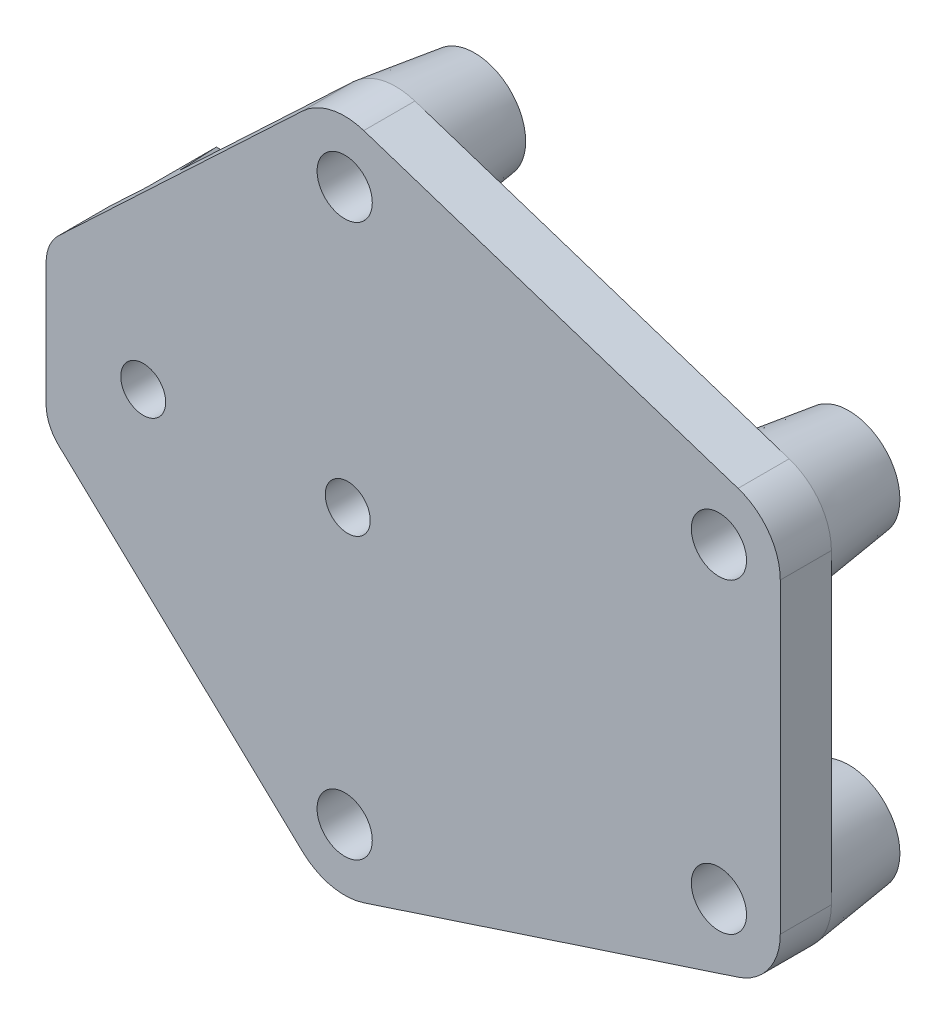
from build123d import *

# Parameters (mm, degrees)
SKETCH_1_R       = 2.7
SKETCH_1_R_2     = 2.2
EXTRUDE_1_DEPTH  = 5
SKETCH_1_4_W     = 29.647183795
SKETCH_1_4_H     = 2
EXTRUDE_2_DEPTH  = 6.8
CHAMFER_1_SIZE   = 3
CHAMFER_1_SIZE_2 = 6.8
CHAMFER_2_SIZE   = 3
CHAMFER_2_SIZE_2 = 6.8


with BuildPart() as part:
    # 草图1 → 凸台-拉伸1 (new body)
    with BuildSketch(Plane.XY):
        with BuildLine():
            Line((-22.414990858, 31.366560458), (-46.243327239, 8.911040306))
            ThreePointArc((-46.243327239, 8.911040306), (-47.17241807, 7.585353438), (-47.5, 6))
            Line((-47.5, 6), (-47.5, -6))
            ThreePointArc((-47.5, -6), (-47.17241807, -7.585353438), (-46.243327239, -8.911040306))
            Line((-46.243327239, -8.911040306), (-22.414990858, -31.366560458))
            ThreePointArc((-22.414990858, -31.366560458), (-19.606220239, -32.85608988), (-16.430695985, -32.701377246))
            Line((-16.430695985, -32.701377246), (20.169304015, -20.701377246))
            ThreePointArc((20.169304015, -20.701377246), (23.158797387, -18.520239758), (24.3, -15))
            Line((24.3, -15), (24.3, 15))
            ThreePointArc((24.3, 15), (23.158797387, 18.520239758), (20.169304015, 20.701377246))
            Line((20.169304015, 20.701377246), (-16.430695985, 32.701377246))
            ThreePointArc((-16.430695985, 32.701377246), (-19.606220239, 32.85608988), (-22.414990858, 31.366560458))
        make_face()
        with Locations((18.3, -15)):
            Circle(SKETCH_1_R, mode=Mode.SUBTRACT)
        with Locations((-38, 0)):
            Circle(SKETCH_1_R_2, mode=Mode.SUBTRACT)
        with Locations((-18, 0)):
            Circle(SKETCH_1_R_2, mode=Mode.SUBTRACT)
        with Locations((-18.3, 27)):
            Circle(SKETCH_1_R, mode=Mode.SUBTRACT)
        with Locations((18.3, 15)):
            Circle(SKETCH_1_R, mode=Mode.SUBTRACT)
        with Locations((-18.3, -27)):
            Circle(SKETCH_1_R, mode=Mode.SUBTRACT)
    extrude(amount=EXTRUDE_1_DEPTH)

    # 草图4 → 旋转1 (revolve)
    with BuildSketch(Plane(origin=(6.216937636, 18.961659791, 0), x_dir=(-0.9502295409734977, 0.31155066917163887, 0), z_dir=(-0.31155066917163887, -0.9502295409734977, 0)), mode=Mode.PRIVATE) as revolve_1_sk:
        Polygon((-6.715940562, 0), (-7.715940562, 7.7), (-10.015940562, 7.7), (-10.015940562, 0), align=None)
    revolve_1 = revolve(revolve_1_sk.sketch.rotate(Axis((18.3, 15, 4.45283877), (0, 0, -1)), 161.847294113), axis=Axis((18.3, 15, 4.45283877), (0, 0, -1)))

    # 草图4<3> → 旋转2 (revolve)
    with BuildSketch(Plane(origin=(6.216937636, 18.961659791, 0), x_dir=(-0.9502295409734977, 0.31155066917163887, 0), z_dir=(-0.31155066917163887, -0.9502295409734977, 0)), mode=Mode.PRIVATE) as revolve_2_sk:
        Polygon((30.801068667, 7.7), (28.501068667, 7.7), (28.501068667, 0), (31.801068667, 0), align=None)
    revolve_2 = revolve(revolve_2_sk.sketch.rotate(Axis((-18.3, 27, 0), (0, 0, -1)), 161.847294113), axis=Axis((-18.3, 27, 0), (0, 0, -1)))

    # 镜向1: 旋转1, 旋转2 across plane
    add(revolve_1.mirror(Plane.ZX))
    add(revolve_2.mirror(Plane.ZX))

    # 草图1<4> → 凸台-拉伸2 (add)
    with BuildSketch(Plane.XY):
        with Locations((-27.823591898, 11.3)):
            Rectangle(SKETCH_1_4_W, SKETCH_1_4_H)
        with Locations((-27.823591898, -11.3)):
            Rectangle(SKETCH_1_4_W, SKETCH_1_4_H)
    extrude(amount=-EXTRUDE_2_DEPTH)

    # 倒角1
    # the kernel refuses this chamfer: 6.8, 3 mm, written as the material it adds along each edge
    with BuildSketch(Plane(origin=(-13, 12.3, 0), x_dir=(0, 0.9968133817371192, 0.07976892872421078), z_dir=(-1, 0, 0))) as chamfer_1_piece_1_section:
        Polygon((CHAMFER_1_SIZE * 0.996813381737, CHAMFER_1_SIZE * 0.0797689287242), (-CHAMFER_1_SIZE_2 * 0.0797689287242, CHAMFER_1_SIZE_2 * 0.996813381737), (0, 0), align=None)
    chamfer_1_piece_1 = extrude(amount=29.647183795, mode=Mode.PRIVATE)
    chamfer_1_piece_1 = split(chamfer_1_piece_1, bisect_by=Plane(origin=(-34.073753533, 20.379491281, -2.31410284), z_dir=(0.685831809699718, -0.7277600764015637, 0)), keep=Keep.TOP, mode=Mode.PRIVATE)
    chamfer_1_piece_1 = split(chamfer_1_piece_1, bisect_by=Plane(origin=(-27.32988888, 13.223341061, -6.8), z_dir=(0, 0, 1)), keep=Keep.TOP, mode=Mode.PRIVATE)
    add(chamfer_1_piece_1)

    # 倒角2
    # the kernel refuses this chamfer: 6.8, 3 mm, written as the material it adds along each edge
    with BuildSketch(Plane(origin=(-42.647183795, -12.3, 0), x_dir=(0, -0.9968133817371192, 0.07976892872421078), z_dir=(1, 0, 0))) as chamfer_2_piece_1_section:
        Polygon((CHAMFER_2_SIZE * 0.996813381737, CHAMFER_2_SIZE * 0.0797689287242), (-CHAMFER_2_SIZE_2 * 0.0797689287242, CHAMFER_2_SIZE_2 * 0.996813381737), (0, 0), align=None)
    chamfer_2_piece_1 = extrude(amount=29.647183795, mode=Mode.PRIVATE)
    chamfer_2_piece_1 = split(chamfer_2_piece_1, bisect_by=Plane(origin=(-34.073753533, -20.379491281, -2.31410284), z_dir=(0.6858318096997175, 0.7277600764015641, 0)), keep=Keep.TOP, mode=Mode.PRIVATE)
    chamfer_2_piece_1 = split(chamfer_2_piece_1, bisect_by=Plane(origin=(-27.32988888, -13.223341061, -6.8), z_dir=(0, 0, 1)), keep=Keep.TOP, mode=Mode.PRIVATE)
    add(chamfer_2_piece_1)


solid = part.part
